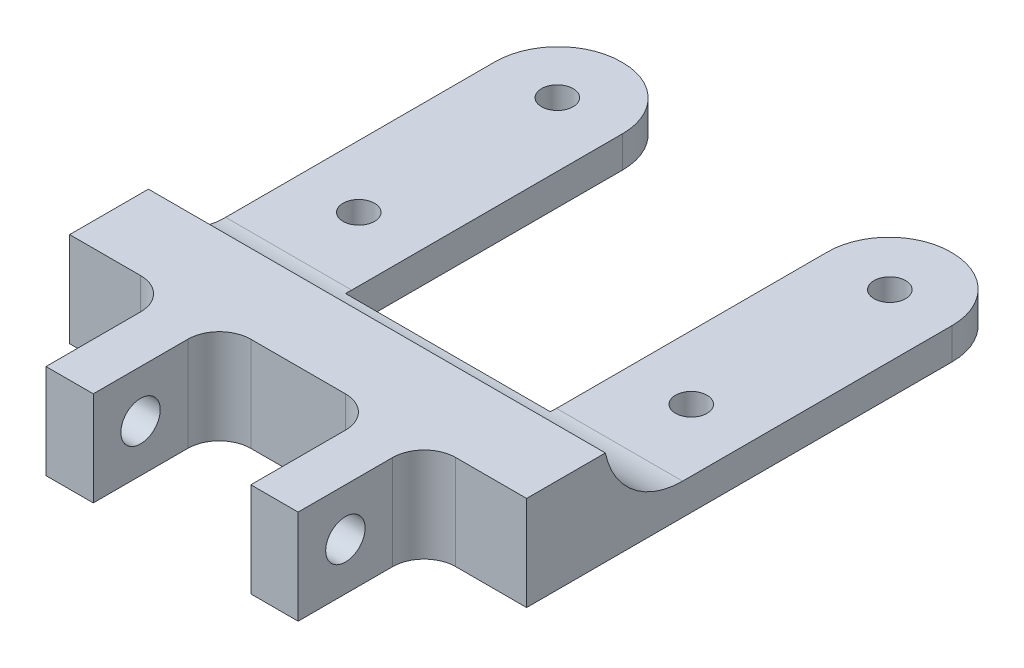
from build123d import *

# Parameters (mm, degrees)
SKETCH1_R                = 1
BOSS_EXTRUDE1_DEPTH      = 2
BOSS_EXTRUDE2_DEPTH      = 4
BOSS_EXTRUDE2_DEPTH_BACK = 2
SKETCH2_W                = 29
SKETCH2_H                = 5
FILLET1_R                = 5
SKETCH3_W                = 3
SKETCH3_H                = 6
BOSS_EXTRUDE3_DEPTH      = 8
FILLET2_R                = 2
CUT_EXTRUDE1_DEPTH       = 15
CUT_EXTRUDE1_DEPTH_BACK  = 7
SKETCH4_R                = 1.25


with BuildPart() as part:
    # Sketch1 → Boss-Extrude1 (new body)
    with BuildSketch(Plane(origin=(0, 0, 0), x_dir=(1, 0, 0), z_dir=(0, 1, 0))):
        with BuildLine():
            Line((24.9, 26), (25, 26))
            ThreePointArc((25, 26), (27.828427125, 24.828427125), (29, 22))
            Line((29, 22), (29, 0))
            Line((29, 0), (0, 0))
            Line((0, 0), (0, 22))
            ThreePointArc((0, 22), (1.171572875, 24.828427125), (4, 26))
            Line((4, 26), (4.1, 26))
            ThreePointArc((4.1, 26), (6.857716447, 24.857716447), (8, 22.1))
            Line((8, 22.1), (8, 4.5))
            Line((8, 4.5), (21, 4.5))
            Line((21, 4.5), (21, 22.1))
            ThreePointArc((21, 22.1), (22.142283553, 24.857716447), (24.9, 26))
        make_face()
        with Locations(Location((3.95, 22, 0), (0, 0, 270))):
            Circle(SKETCH1_R, mode=Mode.SUBTRACT)
        with Locations(Location((25.05, 22, 0), (0, 0, 270))):
            Circle(SKETCH1_R, mode=Mode.SUBTRACT)
        with Locations(Location((25.05, 9.4, 0), (0, 0, 270))):
            Circle(SKETCH1_R, mode=Mode.SUBTRACT)
        with Locations(Location((3.95, 9.4, 0), (0, 0, 270))):
            Circle(SKETCH1_R, mode=Mode.SUBTRACT)
    extrude(amount=BOSS_EXTRUDE1_DEPTH)

    # Sketch2 → Boss-Extrude2 (add, two sides: drawn at the far end of the back side and taken through both)
    with BuildSketch(Plane(origin=(0, 2, 0), x_dir=(1, 0, 0), z_dir=(0, 1, 0)).offset(-BOSS_EXTRUDE2_DEPTH_BACK)):
        with Locations((14.5, -2.5)):
            Rectangle(SKETCH2_W, SKETCH2_H)
    extrude(amount=BOSS_EXTRUDE2_DEPTH + BOSS_EXTRUDE2_DEPTH_BACK)

    # Fillet1
    # the kernel refuses this fillet: 5 mm, written as the material it adds along each edge
    with BuildSketch(Plane(origin=(29, 2, 0), x_dir=(0, 0, -1), z_dir=(-1, 0, 0))) as fillet1_piece_1_section:
        with BuildLine():
            CenterArc((4.898979486, -5), FILLET1_R, 90, 78.463040967)
            Line((0, -4), (0, 0))
            Line((0, 0), (4.898979486, 0))
        make_face()
    fillet1_piece_1 = extrude(amount=41.247448714, mode=Mode.PRIVATE)
    fillet1_piece_1 = split(fillet1_piece_1, bisect_by=Plane(origin=(21, 2, 0), z_dir=(1, 0, 0)), keep=Keep.TOP, mode=Mode.PRIVATE)
    add(fillet1_piece_1)
    with BuildSketch(Plane(origin=(29, 2, 0), x_dir=(0, 0, -1), z_dir=(-1, 0, 0))) as fillet1_piece_2_section:
        with BuildLine():
            CenterArc((4.898979486, -5), FILLET1_R, 90, 78.463040967)
            Line((0, -4), (0, 0))
            Line((0, 0), (4.898979486, 0))
        make_face()
    fillet1_piece_2 = extrude(amount=29, mode=Mode.PRIVATE)
    fillet1_piece_2 = split(fillet1_piece_2, bisect_by=Plane(origin=(29, 2, -4.5), z_dir=(0, 0, 1)), keep=Keep.TOP, mode=Mode.PRIVATE)
    add(fillet1_piece_2)
    with BuildSketch(Plane(origin=(41.247448714, 2, 0), x_dir=(0, 0, -1), z_dir=(-1, 0, 0))) as fillet1_piece_3_section:
        with BuildLine():
            CenterArc((4.898979486, -5), FILLET1_R, 90, 78.463040967)
            Line((0, -4), (0, 0))
            Line((0, 0), (4.898979486, 0))
        make_face()
    fillet1_piece_3 = extrude(amount=41.247448714, mode=Mode.PRIVATE)
    fillet1_piece_3 = split(fillet1_piece_3, bisect_by=Plane(origin=(8, 2, 0), z_dir=(-1, 0, 0)), keep=Keep.TOP, mode=Mode.PRIVATE)
    add(fillet1_piece_3)

    # Sketch3 → Boss-Extrude3 (add)
    with BuildSketch(Plane.XY.offset(5)):
        with Locations((8, 3)):
            Rectangle(SKETCH3_W, SKETCH3_H)
        with Locations((21, 3)):
            Rectangle(SKETCH3_W, SKETCH3_H)
    extrude(amount=BOSS_EXTRUDE3_DEPTH)

    # Fillet2
    fillet2_edges = [part.edges().sort_by_distance(p)[0] for p in [
        (9.5, 3, 5),
        (6.5, 3, 5),
        (19.5, 3, 5),
        (22.5, 3, 5),
    ]]
    fillet(fillet2_edges, radius=FILLET2_R)

    # Sketch4 → Cut-Extrude1 (cut, two sides: drawn at the far end of the back side and taken through both)
    with BuildSketch(Plane(origin=(9.5, 0, 0), x_dir=(0, 0, -1), z_dir=(1, 0, 0)).offset(-CUT_EXTRUDE1_DEPTH_BACK)):
        with Locations(Location((-10, 3, 0), (0, 0, 180))):
            Circle(SKETCH4_R)
    extrude(amount=CUT_EXTRUDE1_DEPTH + CUT_EXTRUDE1_DEPTH_BACK, mode=Mode.SUBTRACT)


solid = part.part
